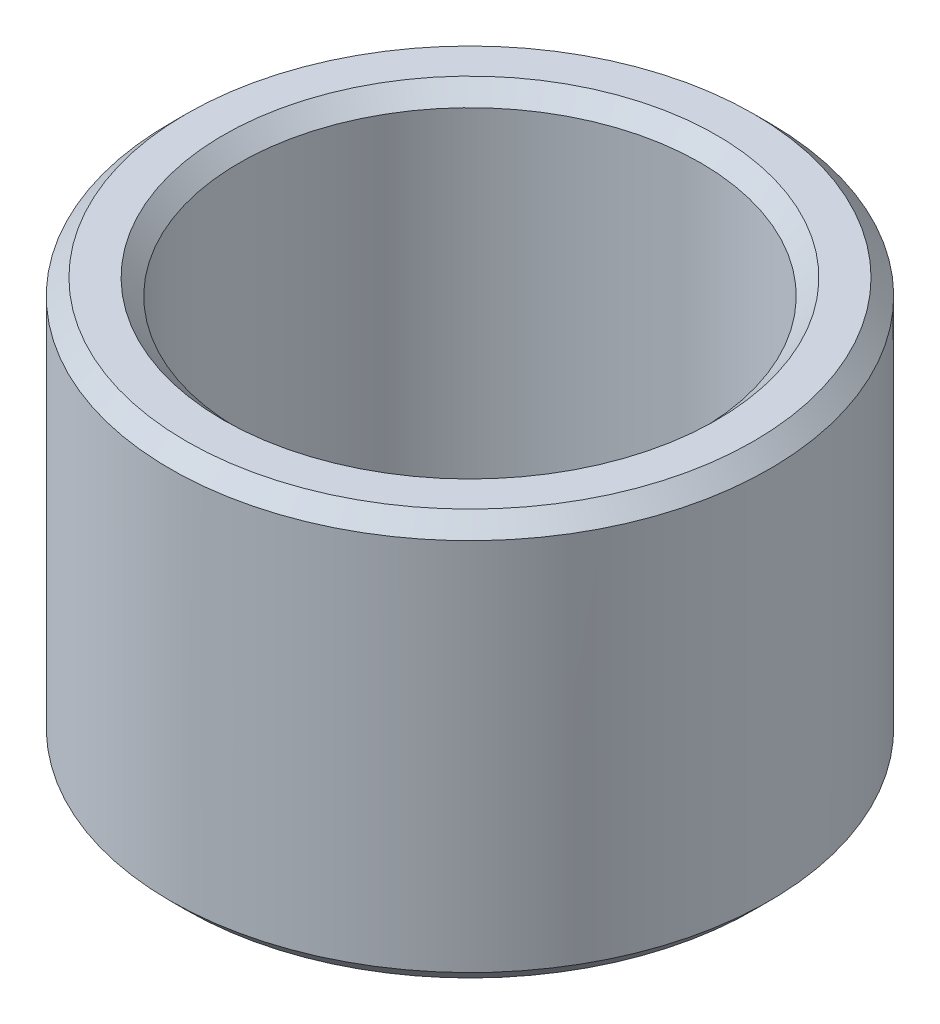
from build123d import *

# Parameters (mm, degrees)
SKETCH1_R           = 35
BOSS_EXTRUDE1_DEPTH = 47.433711059
SKETCH2_R           = 26.94909687
CUT_EXTRUDE1_DEPTH  = 69.556231991
CHAMFER1_SIZE       = 1.871509031


with BuildPart() as part:
    # Sketch1 → Boss-Extrude1 (new body)
    with BuildSketch(Plane(origin=(0, 0, 0), x_dir=(1, 0, 0), z_dir=(0, 1, 0))):
        Circle(SKETCH1_R)
    extrude(amount=BOSS_EXTRUDE1_DEPTH)

    # Sketch2 → Cut-Extrude1 (cut, through all)
    with BuildSketch(Plane(origin=(0, 0, 0), x_dir=(1, 0, 0), z_dir=(0, 1, 0))):
        Circle(SKETCH2_R)
    extrude(amount=CUT_EXTRUDE1_DEPTH, mode=Mode.SUBTRACT)

    # Chamfer1
    chamfer1_edges = [part.edges().sort_by_distance(p)[0] for p in [
        (-26.94909687, 47.433711059, 0),
        (-26.94909687, 0, 0),
        (-35, 0, 0),
        (-35, 47.433711059, 0),
    ]]
    chamfer(chamfer1_edges, length=CHAMFER1_SIZE)


solid = part.part
